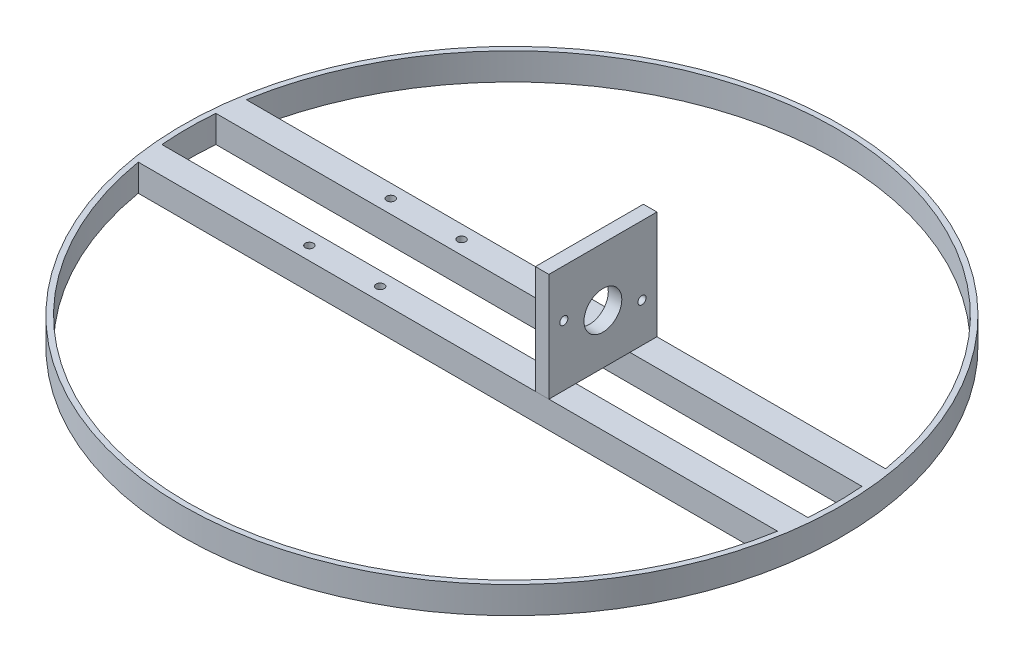
from build123d import *

# Parameters (mm, degrees)
SKETCH1_R               = 122
SKETCH1_R_2             = 120
BOSS_EXTRUDE1_DEPTH     = 10
SKETCH2_W               = 10
SKETCH2_H               = 10
BOSS_EXTRUDE2_DEPTH     = 300
CUT_EXTRUDE5_DEPTH      = 374.854124119
CUT_EXTRUDE5_DEPTH_BACK = 374.854124119
SKETCH3_OUTSIDE_W       = 379.366
SKETCH3_OUTSIDE_H       = 323.366
SKETCH3_OUTSIDE_R       = 122
BOSS_EXTRUDE3_START     = -105
SKETCH4_W               = 40
SKETCH4_H               = 40
SKETCH4_R               = 1.5
SKETCH4_R_2             = 7
BOSS_EXTRUDE3_DEPTH     = 5
SKETCH7_R               = 1.5
CUT_EXTRUDE6_DEPTH      = 10


with BuildPart() as part:
    # Sketch1 → Boss-Extrude1 (new body)
    with BuildSketch(Plane(origin=(0, 0, 0), x_dir=(1, 0, 0), z_dir=(0, 1, 0))):
        with Locations((-133.671737878, -100.860732568)):
            Circle(SKETCH1_R)
        with Locations((-133.671737878, -100.860732568)):
            Circle(SKETCH1_R_2, mode=Mode.SUBTRACT)
    extrude(amount=BOSS_EXTRUDE1_DEPTH)

    # Sketch2 → Boss-Extrude2 (add)
    with BuildSketch(Plane(origin=(0, 0, 0), x_dir=(0, 0, -1), z_dir=(1, 0, 0))):
        with Locations((-115.860732568, 5)):
            Rectangle(SKETCH2_W, SKETCH2_H)
        with Locations((-85.860732568, 5)):
            Rectangle(SKETCH2_W, SKETCH2_H)
    extrude(amount=-BOSS_EXTRUDE2_DEPTH)

    # Sketch3 outside → Cut-Extrude5 (cut, two sides: drawn at the far end of the back side and taken through both)
    with BuildSketch(Plane(origin=(0, 0, 0), x_dir=(1, 0, 0), z_dir=(0, 1, 0)).offset(-CUT_EXTRUDE5_DEPTH_BACK)):
        with Locations((-150, -100.861)):
            Rectangle(SKETCH3_OUTSIDE_W, SKETCH3_OUTSIDE_H)
        with Locations((-133.671737878, -100.860732568)):
            Circle(SKETCH3_OUTSIDE_R, mode=Mode.SUBTRACT)
    extrude(amount=CUT_EXTRUDE5_DEPTH + CUT_EXTRUDE5_DEPTH_BACK, mode=Mode.SUBTRACT)

    # Sketch7 → Cut-Extrude6 (cut)
    with BuildSketch(Plane(origin=(0, 10, 0), x_dir=(1, 0, 0), z_dir=(0, 1, 0))):
        with Locations((-193.582393476, -85.798627548)):
            Circle(SKETCH7_R)
        with Locations((-167.381064257, -85.798627548)):
            Circle(SKETCH7_R)
        with Locations((-193.582393476, -115.922837589)):
            Circle(SKETCH7_R)
        with Locations((-167.381064257, -115.922837589)):
            Circle(SKETCH7_R)
    extrude(amount=-CUT_EXTRUDE6_DEPTH, mode=Mode.SUBTRACT)


with BuildPart() as body_2:
    # Sketch4 → Boss-Extrude3 (new body)
    with BuildSketch(Plane(origin=(0, 0, 0), x_dir=(0, 0, -1), z_dir=(1, 0, 0)).offset(BOSS_EXTRUDE3_START)):
        with Locations((-100.860732568, 30)):
            Rectangle(SKETCH4_W, SKETCH4_H)
        with Locations((-86.38915947, 24.519848777)):
            Circle(SKETCH4_R, mode=Mode.SUBTRACT)
        with Locations((-115.332305667, 32.412521849)):
            Circle(SKETCH4_R, mode=Mode.SUBTRACT)
        with Locations((-100.860732568, 28.466185313)):
            Circle(SKETCH4_R_2, mode=Mode.SUBTRACT)
    extrude(amount=BOSS_EXTRUDE3_DEPTH)


solid = Compound([part.part, body_2.part])
